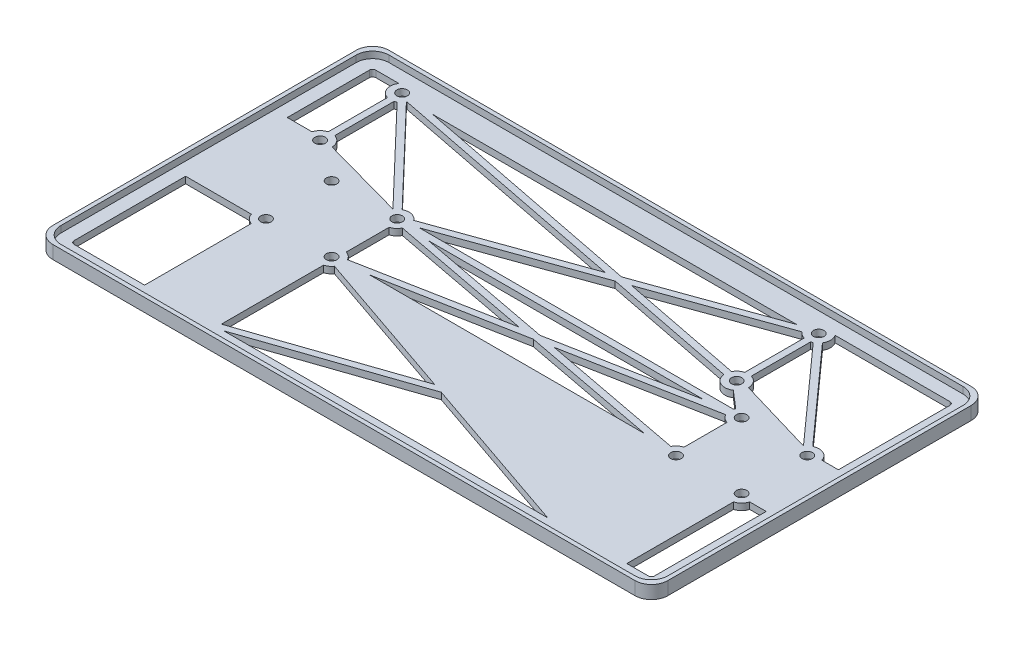
from build123d import *

# Parameters (mm, degrees)
SKETCH1_W           = 238.125
SKETCH1_H           = 130.175
BOSS_EXTRUDE1_DEPTH = 2.54
FILLET1_R           = 6.35
CUT_EXTRUDE1_REACH  = 137.716
SKETCH2_R           = 2.032
BOSS_EXTRUDE2_START = 2.54
BOSS_EXTRUDE2_DEPTH = 2.54
CUT_EXTRUDE3_REACH  = 137.716


with BuildPart() as part:
    # Sketch1 → Boss-Extrude1 (new body)
    with BuildSketch(Plane(origin=(0, 0, 0), x_dir=(1, 0, 0), z_dir=(0, 1, 0))):
        Rectangle(SKETCH1_W, SKETCH1_H)
    extrude(amount=BOSS_EXTRUDE1_DEPTH)

    # Fillet1
    fillet1_edges = [part.edges().sort_by_distance(p)[0] for p in [
        (119.0625, 1.27, -65.0875),
        (119.0625, 1.27, 65.0875),
        (-119.0625, 1.27, -65.0875),
        (-119.0625, 1.27, 65.0875),
    ]]
    fillet(fillet1_edges, radius=FILLET1_R)

    # Sketch2 → Cut-Extrude1 (cut, up to next)
    with BuildSketch(Plane(origin=(0, 2.54, 0), x_dir=(1, 0, 0), z_dir=(0, 1, 0)), mode=Mode.PRIVATE) as cut_extrude1_sk1:
        with Locations((76.2, 12.7)):
            Circle(SKETCH2_R)
    cut_extrude1_tool1 = extrude(cut_extrude1_sk1.sketch, amount=-CUT_EXTRUDE1_REACH, mode=Mode.PRIVATE) & part.part
    # Sketch2 → Cut-Extrude1 (cut, up to next)
    with BuildSketch(Plane(origin=(0, 2.54, 0), x_dir=(1, 0, 0), z_dir=(0, 1, 0)), mode=Mode.PRIVATE) as cut_extrude1_sk2:
        with Locations((76.2, -12.7)):
            Circle(SKETCH2_R)
    cut_extrude1_tool2 = extrude(cut_extrude1_sk2.sketch, amount=-CUT_EXTRUDE1_REACH, mode=Mode.PRIVATE) & part.part
    # Sketch2 → Cut-Extrude1 (cut, up to next)
    with BuildSketch(Plane(origin=(0, 2.54, 0), x_dir=(1, 0, 0), z_dir=(0, 1, 0)), mode=Mode.PRIVATE) as cut_extrude1_sk3:
        with Locations((-57.15, -12.7)):
            Circle(SKETCH2_R)
    cut_extrude1_tool3 = extrude(cut_extrude1_sk3.sketch, amount=-CUT_EXTRUDE1_REACH, mode=Mode.PRIVATE) & part.part
    # Sketch2 → Cut-Extrude1 (cut, up to next)
    with BuildSketch(Plane(origin=(0, 2.54, 0), x_dir=(1, 0, 0), z_dir=(0, 1, 0)), mode=Mode.PRIVATE) as cut_extrude1_sk4:
        with Locations((-82.55, -12.7)):
            Circle(SKETCH2_R)
    cut_extrude1_tool4 = extrude(cut_extrude1_sk4.sketch, amount=-CUT_EXTRUDE1_REACH, mode=Mode.PRIVATE) & part.part
    # Sketch2 → Cut-Extrude1 (cut, up to next)
    with BuildSketch(Plane(origin=(0, 2.54, 0), x_dir=(1, 0, 0), z_dir=(0, 1, 0)), mode=Mode.PRIVATE) as cut_extrude1_sk5:
        with Locations((-57.15, 12.7)):
            Circle(SKETCH2_R)
    cut_extrude1_tool5 = extrude(cut_extrude1_sk5.sketch, amount=-CUT_EXTRUDE1_REACH, mode=Mode.PRIVATE) & part.part
    # Sketch2 → Cut-Extrude1 (cut, up to next)
    with BuildSketch(Plane(origin=(0, 2.54, 0), x_dir=(1, 0, 0), z_dir=(0, 1, 0)), mode=Mode.PRIVATE) as cut_extrude1_sk6:
        with Locations((-82.55, 12.7)):
            Circle(SKETCH2_R)
    cut_extrude1_tool6 = extrude(cut_extrude1_sk6.sketch, amount=-CUT_EXTRUDE1_REACH, mode=Mode.PRIVATE) & part.part
    # Sketch2 → Cut-Extrude1 (cut, up to next)
    with BuildSketch(Plane(origin=(0, 2.54, 0), x_dir=(1, 0, 0), z_dir=(0, 1, 0)), mode=Mode.PRIVATE) as cut_extrude1_sk7:
        with Locations((62.865, 24.13)):
            Circle(SKETCH2_R)
    cut_extrude1_tool7 = extrude(cut_extrude1_sk7.sketch, amount=-CUT_EXTRUDE1_REACH, mode=Mode.PRIVATE) & part.part
    # Sketch2 → Cut-Extrude1 (cut, up to next)
    with BuildSketch(Plane(origin=(0, 2.54, 0), x_dir=(1, 0, 0), z_dir=(0, 1, 0)), mode=Mode.PRIVATE) as cut_extrude1_sk8:
        with Locations((62.865, 55.88)):
            Circle(SKETCH2_R)
    cut_extrude1_tool8 = extrude(cut_extrude1_sk8.sketch, amount=-CUT_EXTRUDE1_REACH, mode=Mode.PRIVATE) & part.part
    # Sketch2 → Cut-Extrude1 (cut, up to next)
    with BuildSketch(Plane(origin=(0, 2.54, 0), x_dir=(1, 0, 0), z_dir=(0, 1, 0)), mode=Mode.PRIVATE) as cut_extrude1_sk9:
        with Locations((-98.425, 24.13)):
            Circle(SKETCH2_R)
    cut_extrude1_tool9 = extrude(cut_extrude1_sk9.sketch, amount=-CUT_EXTRUDE1_REACH, mode=Mode.PRIVATE) & part.part
    # Sketch2 → Cut-Extrude1 (cut, up to next)
    with BuildSketch(Plane(origin=(0, 2.54, 0), x_dir=(1, 0, 0), z_dir=(0, 1, 0)), mode=Mode.PRIVATE) as cut_extrude1_sk10:
        with Locations((-98.425, 55.88)):
            Circle(SKETCH2_R)
    cut_extrude1_tool10 = extrude(cut_extrude1_sk10.sketch, amount=-CUT_EXTRUDE1_REACH, mode=Mode.PRIVATE) & part.part
    # Sketch2 → Cut-Extrude1 (cut, up to next)
    with BuildSketch(Plane(origin=(0, 2.54, 0), x_dir=(1, 0, 0), z_dir=(0, 1, 0)), mode=Mode.PRIVATE) as cut_extrude1_sk11:
        with Locations((101.6, -12.7)):
            Circle(SKETCH2_R)
    cut_extrude1_tool11 = extrude(cut_extrude1_sk11.sketch, amount=-CUT_EXTRUDE1_REACH, mode=Mode.PRIVATE) & part.part
    # Sketch2 → Cut-Extrude1 (cut, up to next)
    with BuildSketch(Plane(origin=(0, 2.54, 0), x_dir=(1, 0, 0), z_dir=(0, 1, 0)), mode=Mode.PRIVATE) as cut_extrude1_sk12:
        with Locations((101.6, 12.7)):
            Circle(SKETCH2_R)
    cut_extrude1_tool12 = extrude(cut_extrude1_sk12.sketch, amount=-CUT_EXTRUDE1_REACH, mode=Mode.PRIVATE) & part.part
    add(cut_extrude1_tool1.solids().sort_by_distance((76.2, 2.54, -12.7))[0], mode=Mode.SUBTRACT)
    add(cut_extrude1_tool2.solids().sort_by_distance((76.2, 2.54, 12.7))[0], mode=Mode.SUBTRACT)
    add(cut_extrude1_tool3.solids().sort_by_distance((-57.15, 2.54, 12.7))[0], mode=Mode.SUBTRACT)
    add(cut_extrude1_tool4.solids().sort_by_distance((-82.55, 2.54, 12.7))[0], mode=Mode.SUBTRACT)
    add(cut_extrude1_tool5.solids().sort_by_distance((-57.15, 2.54, -12.7))[0], mode=Mode.SUBTRACT)
    add(cut_extrude1_tool6.solids().sort_by_distance((-82.55, 2.54, -12.7))[0], mode=Mode.SUBTRACT)
    add(cut_extrude1_tool7.solids().sort_by_distance((62.865, 2.54, -24.13))[0], mode=Mode.SUBTRACT)
    add(cut_extrude1_tool8.solids().sort_by_distance((62.865, 2.54, -55.88))[0], mode=Mode.SUBTRACT)
    add(cut_extrude1_tool9.solids().sort_by_distance((-98.425, 2.54, -24.13))[0], mode=Mode.SUBTRACT)
    add(cut_extrude1_tool10.solids().sort_by_distance((-98.425, 2.54, -55.88))[0], mode=Mode.SUBTRACT)
    add(cut_extrude1_tool11.solids().sort_by_distance((101.6, 2.54, 12.7))[0], mode=Mode.SUBTRACT)
    add(cut_extrude1_tool12.solids().sort_by_distance((101.6, 2.54, -12.7))[0], mode=Mode.SUBTRACT)

    # Sketch3 → Boss-Extrude2 (add)
    with BuildSketch(Plane(origin=(0, 2.54, 0), x_dir=(1, 0, 0), z_dir=(0, 1, 0)).offset(BOSS_EXTRUDE2_START)):
        with BuildLine():
            ThreePointArc((112.7125, -65.0875), (117.202628061, -63.227628061), (119.0625, -58.7375))
            Line((119.0625, -58.7375), (119.0625, 58.7375))
            ThreePointArc((119.0625, 58.7375), (117.202628061, 63.227628061), (112.7125, 65.0875))
            Line((112.7125, 65.0875), (-112.7125, 65.0875))
            ThreePointArc((-112.7125, 65.0875), (-117.202628061, 63.227628061), (-119.0625, 58.7375))
            Line((-119.0625, 58.7375), (-119.0625, -58.7375))
            ThreePointArc((-119.0625, -58.7375), (-117.202628061, -63.227628061), (-112.7125, -65.0875))
            Line((-112.7125, -65.0875), (112.7125, -65.0875))
        make_face()
        with BuildLine():
            Line((-117.475, -57.15), (-117.475, 57.15))
            ThreePointArc((-117.475, 57.15), (-115.615128061, 61.640128061), (-111.125, 63.5))
            Line((-111.125, 63.5), (111.125, 63.5))
            ThreePointArc((111.125, 63.5), (115.615128061, 61.640128061), (117.475, 57.15))
            Line((117.475, 57.15), (117.475, -57.15))
            ThreePointArc((117.475, -57.15), (115.615128061, -61.640128061), (111.125, -63.5))
            Line((111.125, -63.5), (-111.125, -63.5))
            ThreePointArc((-111.125, -63.5), (-115.615128061, -61.640128061), (-117.475, -57.15))
        make_face(mode=Mode.SUBTRACT)
    extrude(amount=-BOSS_EXTRUDE2_DEPTH)

    # Sketch5 → Cut-Extrude3 (cut, up to next)
    with BuildSketch(Plane(origin=(0, 2.54, 0), x_dir=(1, 0, 0), z_dir=(0, 1, 0)), mode=Mode.PRIVATE) as cut_extrude3_sk1:
        with BuildLine():
            Line((-99.695, 28.522070582), (-99.695, 51.487929418))
            ThreePointArc((-99.695, 51.487929418), (-102.719588376, 54.311658621), (-102.226523905, 58.42))
            Line((-102.226523905, 58.42), (-111.125, 58.42))
            ThreePointArc((-111.125, 58.42), (-112.023025612, 58.048025612), (-112.395, 57.15))
            Line((-112.395, 57.15), (-112.395, 25.4))
            Line((-112.395, 25.4), (-102.817070582, 25.4))
            ThreePointArc((-102.817070582, 25.4), (-101.657892204, 27.362892204), (-99.695, 28.522070582))
        make_face()
    cut_extrude3_tool1 = extrude(cut_extrude3_sk1.sketch, amount=-CUT_EXTRUDE3_REACH, mode=Mode.PRIVATE) & part.part
    # Sketch5 → Cut-Extrude3 (cut, up to next)
    with BuildSketch(Plane(origin=(0, 2.54, 0), x_dir=(1, 0, 0), z_dir=(0, 1, 0)), mode=Mode.PRIVATE) as cut_extrude3_sk2:
        with BuildLine():
            ThreePointArc((-96.308209916, 51.827545961), (-96.723112337, 51.636562433), (-97.155, 51.487929418))
            Line((-97.155, 51.487929418), (-97.155, 28.522070582))
            ThreePointArc((-97.155, 28.522070582), (-94.786194799, 26.898082497), (-93.853293286, 24.181785358))
            Line((-93.853293286, 24.181785358), (-61.25249112, 15.153870912))
            Line((-61.25249112, 15.153870912), (-96.308209916, 51.827545961))
        make_face()
    cut_extrude3_tool2 = extrude(cut_extrude3_sk2.sketch, amount=-CUT_EXTRUDE3_REACH, mode=Mode.PRIVATE) & part.part
    # Sketch5 → Cut-Extrude3 (cut, up to next)
    with BuildSketch(Plane(origin=(0, 2.54, 0), x_dir=(1, 0, 0), z_dir=(0, 1, 0)), mode=Mode.PRIVATE) as cut_extrude3_sk3:
        with BuildLine():
            ThreePointArc((-94.360922693, 53.785612347), (-94.415233471, 53.683421664), (-94.472113294, 53.582638321))
            Line((-94.472113294, 53.582638321), (-59.266790084, 16.752454039))
            ThreePointArc((-59.266790084, 16.752454039), (-56.101939455, 17.150253149), (-53.447227224, 15.38191308))
            Line((-53.447227224, 15.38191308), (1.07614546, 34.998787908))
            Line((1.07614546, 34.998787908), (-94.360922693, 53.785612347))
        make_face()
    cut_extrude3_tool3 = extrude(cut_extrude3_sk3.sketch, amount=-CUT_EXTRUDE3_REACH, mode=Mode.PRIVATE) & part.part
    # Sketch5 → Cut-Extrude3 (cut, up to next)
    with BuildSketch(Plane(origin=(0, 2.54, 0), x_dir=(1, 0, 0), z_dir=(0, 1, 0)), mode=Mode.PRIVATE) as cut_extrude3_sk4:
        Polygon((55.58377907, 54.61), (-85.397988031, 54.61), (5.726818547, 36.672045949), align=None)
    cut_extrude3_tool4 = extrude(cut_extrude3_sk4.sketch, amount=-CUT_EXTRUDE3_REACH, mode=Mode.PRIVATE) & part.part
    # Sketch5 → Cut-Extrude3 (cut, up to next)
    with BuildSketch(Plane(origin=(0, 2.54, 0), x_dir=(1, 0, 0), z_dir=(0, 1, 0)), mode=Mode.PRIVATE) as cut_extrude3_sk5:
        with BuildLine():
            Line((58.310337462, 23.732214679), (5.925604925, 34.044169903))
            Line((5.925604925, 34.044169903), (-49.86877907, 13.97))
            Line((-49.86877907, 13.97), (71.807929418, 13.97))
            ThreePointArc((71.807929418, 13.97), (71.911989712, 14.286238245), (72.038786368, 14.594065762))
            Line((72.038786368, 14.594065762), (65.373203543, 20.307422468))
            ThreePointArc((65.373203543, 20.307422468), (60.870181957, 20.016135032), (58.310337462, 23.732214679))
        make_face()
    cut_extrude3_tool5 = extrude(cut_extrude3_sk5.sketch, amount=-CUT_EXTRUDE3_REACH, mode=Mode.PRIVATE) & part.part
    # Sketch5 → Cut-Extrude3 (cut, up to next)
    with BuildSketch(Plane(origin=(0, 2.54, 0), x_dir=(1, 0, 0), z_dir=(0, 1, 0)), mode=Mode.PRIVATE) as cut_extrude3_sk6:
        with BuildLine():
            Line((111.125, 58.42), (66.666523905, 58.42))
            ThreePointArc((66.666523905, 58.42), (67.436454249, 55.95064026), (66.7431887, 53.458670529))
            Line((66.7431887, 53.458670529), (99.612541055, 16.817425281))
            ThreePointArc((99.612541055, 16.817425281), (103.463463701, 16.87500743), (105.992070582, 13.97))
            Line((105.992070582, 13.97), (112.395, 13.97))
            Line((112.395, 13.97), (112.395, 57.15))
            ThreePointArc((112.395, 57.15), (112.023025612, 58.048025612), (111.125, 58.42))
        make_face()
    cut_extrude3_tool6 = extrude(cut_extrude3_sk6.sketch, amount=-CUT_EXTRUDE3_REACH, mode=Mode.PRIVATE) & part.part
    # Sketch5 → Cut-Extrude3 (cut, up to next)
    with BuildSketch(Plane(origin=(0, 2.54, 0), x_dir=(1, 0, 0), z_dir=(0, 1, 0)), mode=Mode.PRIVATE) as cut_extrude3_sk7:
        with BuildLine():
            Line((59.162227224, 53.19808692), (10.576278011, 35.717427944))
            Line((10.576278011, 35.717427944), (58.800922693, 26.224387653))
            ThreePointArc((58.800922693, 26.224387653), (59.961048917, 27.661324413), (61.595, 28.522070582))
            Line((61.595, 28.522070582), (61.595, 51.487929418))
            ThreePointArc((61.595, 51.487929418), (60.235688884, 52.139691583), (59.162227224, 53.19808692))
        make_face()
    cut_extrude3_tool7 = extrude(cut_extrude3_sk7.sketch, amount=-CUT_EXTRUDE3_REACH, mode=Mode.PRIVATE) & part.part
    # Sketch5 → Cut-Extrude3 (cut, up to next)
    with BuildSketch(Plane(origin=(0, 2.54, 0), x_dir=(1, 0, 0), z_dir=(0, 1, 0)), mode=Mode.PRIVATE) as cut_extrude3_sk8:
        with BuildLine():
            Line((97.664237336, 15.185510284), (64.852458945, 51.762574719))
            ThreePointArc((64.852458945, 51.762574719), (64.499508246, 51.610156116), (64.135, 51.487929418))
            Line((64.135, 51.487929418), (64.135, 28.522070582))
            ThreePointArc((64.135, 28.522070582), (66.52690867, 26.867445687), (67.436931884, 24.10504304))
            Line((67.436931884, 24.10504304), (97.664237336, 15.185510284))
        make_face()
    cut_extrude3_tool8 = extrude(cut_extrude3_sk8.sketch, amount=-CUT_EXTRUDE3_REACH, mode=Mode.PRIVATE) & part.part
    # Sketch5 → Cut-Extrude3 (cut, up to next)
    with BuildSketch(Plane(origin=(0, 2.54, 0), x_dir=(1, 0, 0), z_dir=(0, 1, 0)), mode=Mode.PRIVATE) as cut_extrude3_sk9:
        Polygon((62.745125231, 11.43), (-43.695125231, 11.43), (9.525, 1.292833289), align=None)
    cut_extrude3_tool9 = extrude(cut_extrude3_sk9.sketch, amount=-CUT_EXTRUDE3_REACH, mode=Mode.PRIVATE) & part.part
    # Sketch5 → Cut-Extrude3 (cut, up to next)
    with BuildSketch(Plane(origin=(0, 2.54, 0), x_dir=(1, 0, 0), z_dir=(0, 1, 0)), mode=Mode.PRIVATE) as cut_extrude3_sk10:
        with BuildLine():
            ThreePointArc((-53.073132058, 10.630620436), (-54.23521483, 9.177612825), (-55.88, 8.307929418))
            Line((-55.88, 8.307929418), (-55.88, -8.307929418))
            ThreePointArc((-55.88, -8.307929418), (-54.23521483, -9.177612825), (-53.073132058, -10.630620436))
            Line((-53.073132058, -10.630620436), (2.737625231, 0))
            Line((2.737625231, 0), (-53.073132058, 10.630620436))
        make_face()
    cut_extrude3_tool10 = extrude(cut_extrude3_sk10.sketch, amount=-CUT_EXTRUDE3_REACH, mode=Mode.PRIVATE) & part.part
    # Sketch5 → Cut-Extrude3 (cut, up to next)
    with BuildSketch(Plane(origin=(0, 2.54, 0), x_dir=(1, 0, 0), z_dir=(0, 1, 0)), mode=Mode.PRIVATE) as cut_extrude3_sk11:
        with BuildLine():
            Line((-86.942070582, -13.97), (-112.395, -13.97))
            Line((-112.395, -13.97), (-112.395, -57.15))
            ThreePointArc((-112.395, -57.15), (-112.023025612, -58.048025612), (-111.125, -58.42))
            Line((-111.125, -58.42), (-83.82, -58.42))
            Line((-83.82, -58.42), (-83.82, -17.092070582))
            ThreePointArc((-83.82, -17.092070582), (-85.782892204, -15.932892204), (-86.942070582, -13.97))
        make_face()
    cut_extrude3_tool11 = extrude(cut_extrude3_sk11.sketch, amount=-CUT_EXTRUDE3_REACH, mode=Mode.PRIVATE) & part.part
    # Sketch5 → Cut-Extrude3 (cut, up to next)
    with BuildSketch(Plane(origin=(0, 2.54, 0), x_dir=(1, 0, 0), z_dir=(0, 1, 0)), mode=Mode.PRIVATE) as cut_extrude3_sk12:
        with BuildLine():
            ThreePointArc((74.93, 8.307929418), (73.28521483, 9.177612825), (72.123132058, 10.630620436))
            Line((72.123132058, 10.630620436), (16.312374769, 0))
            Line((16.312374769, 0), (72.123132058, -10.630620436))
            ThreePointArc((72.123132058, -10.630620436), (73.28521483, -9.177612825), (74.93, -8.307929418))
            Line((74.93, -8.307929418), (74.93, 8.307929418))
        make_face()
    cut_extrude3_tool12 = extrude(cut_extrude3_sk12.sketch, amount=-CUT_EXTRUDE3_REACH, mode=Mode.PRIVATE) & part.part
    # Sketch5 → Cut-Extrude3 (cut, up to next)
    with BuildSketch(Plane(origin=(0, 2.54, 0), x_dir=(1, 0, 0), z_dir=(0, 1, 0)), mode=Mode.PRIVATE) as cut_extrude3_sk13:
        with BuildLine():
            Line((112.395, -57.15), (112.395, -13.97))
            Line((112.395, -13.97), (105.992070582, -13.97))
            ThreePointArc((105.992070582, -13.97), (104.832892204, -15.932892204), (102.87, -17.092070582))
            Line((102.87, -17.092070582), (102.87, -58.42))
            Line((102.87, -58.42), (111.125, -58.42))
            ThreePointArc((111.125, -58.42), (112.023025612, -58.048025612), (112.395, -57.15))
        make_face()
    cut_extrude3_tool13 = extrude(cut_extrude3_sk13.sketch, amount=-CUT_EXTRUDE3_REACH, mode=Mode.PRIVATE) & part.part
    # Sketch5 → Cut-Extrude3 (cut, up to next)
    with BuildSketch(Plane(origin=(0, 2.54, 0), x_dir=(1, 0, 0), z_dir=(0, 1, 0)), mode=Mode.PRIVATE) as cut_extrude3_sk14:
        Polygon((62.745125231, -11.43), (9.525, -1.292833289), (-43.695125231, -11.43), align=None)
    cut_extrude3_tool14 = extrude(cut_extrude3_sk14.sketch, amount=-CUT_EXTRUDE3_REACH, mode=Mode.PRIVATE) & part.part
    # Sketch5 → Cut-Extrude3 (cut, up to next)
    with BuildSketch(Plane(origin=(0, 2.54, 0), x_dir=(1, 0, 0), z_dir=(0, 1, 0)), mode=Mode.PRIVATE) as cut_extrude3_sk15:
        with BuildLine():
            ThreePointArc((-53.40723053, -15.325806675), (-54.492578978, -16.42038943), (-55.88, -17.092070582))
            Line((-55.88, -17.092070582), (-55.88, -56.642))
            Line((-55.88, -56.642), (5.609166667, -35.56))
            Line((5.609166667, -35.56), (-53.40723053, -15.325806675))
        make_face()
    cut_extrude3_tool15 = extrude(cut_extrude3_sk15.sketch, amount=-CUT_EXTRUDE3_REACH, mode=Mode.PRIVATE) & part.part
    # Sketch5 → Cut-Extrude3 (cut, up to next)
    with BuildSketch(Plane(origin=(0, 2.54, 0), x_dir=(1, 0, 0), z_dir=(0, 1, 0)), mode=Mode.PRIVATE) as cut_extrude3_sk16:
        Polygon((9.525, -36.902571429), (-53.234166667, -58.42), (72.284166667, -58.42), align=None)
    cut_extrude3_tool16 = extrude(cut_extrude3_sk16.sketch, amount=-CUT_EXTRUDE3_REACH, mode=Mode.PRIVATE) & part.part
    add(cut_extrude3_tool1.solids().sort_by_distance((-106.355054, 2.54, -41.520755))[0], mode=Mode.SUBTRACT)
    add(cut_extrude3_tool2.solids().sort_by_distance((-84.979205, 2.54, -31.053992))[0], mode=Mode.SUBTRACT)
    add(cut_extrude3_tool3.solids().sort_by_distance((-50.111045, 2.54, -34.468513))[0], mode=Mode.SUBTRACT)
    add(cut_extrude3_tool4.solids().sort_by_distance((-8.02913, 2.54, -48.630682))[0], mode=Mode.SUBTRACT)
    add(cut_extrude3_tool5.solids().sort_by_distance((14.160577, 2.54, -21.067286))[0], mode=Mode.SUBTRACT)
    add(cut_extrude3_tool6.solids().sort_by_distance((95.332526, 2.54, -41.188451))[0], mode=Mode.SUBTRACT)
    add(cut_extrude3_tool7.solids().sort_by_distance((44.397742, 2.54, -38.494315))[0], mode=Mode.SUBTRACT)
    add(cut_extrude3_tool8.solids().sort_by_distance((75.518973, 2.54, -31.021542))[0], mode=Mode.SUBTRACT)
    add(cut_extrude3_tool9.solids().sort_by_distance((9.525, 2.54, -8.050944))[0], mode=Mode.SUBTRACT)
    add(cut_extrude3_tool10.solids().sort_by_distance((-36.057422, 2.54, 0))[0], mode=Mode.SUBTRACT)
    add(cut_extrude3_tool11.solids().sort_by_distance((-98.171627, 2.54, 36.298225))[0], mode=Mode.SUBTRACT)
    add(cut_extrude3_tool12.solids().sort_by_distance((55.107422, 2.54, 0))[0], mode=Mode.SUBTRACT)
    add(cut_extrude3_tool13.solids().sort_by_distance((107.684702, 2.54, 36.508102))[0], mode=Mode.SUBTRACT)
    add(cut_extrude3_tool14.solids().sort_by_distance((9.525, 2.54, 8.050944))[0], mode=Mode.SUBTRACT)
    add(cut_extrude3_tool15.solids().sort_by_distance((-35.326556, 2.54, 35.617722))[0], mode=Mode.SUBTRACT)
    add(cut_extrude3_tool16.solids().sort_by_distance((9.525, 2.54, 51.247524))[0], mode=Mode.SUBTRACT)


solid = part.part
